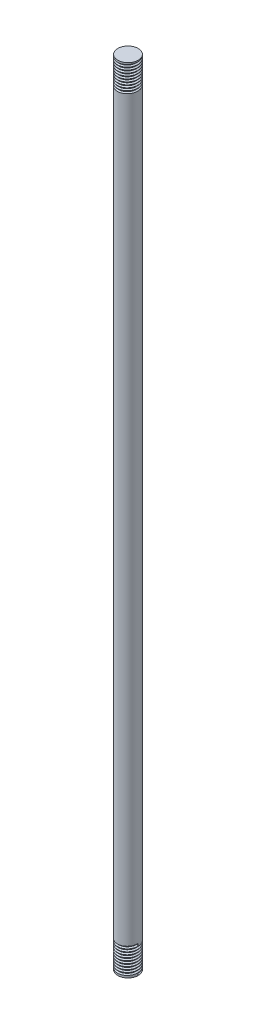
from build123d import *
from build123d.topology import SkipClean

# Parameters (mm, degrees)
SKETCH1_R           = 4
BOSS_EXTRUDE1_DEPTH = 310
THREAD1_PITCH       = 1
THREAD2_PITCH       = 1


with BuildPart() as part:
    # Sketch1 → Boss-Extrude1 (new body)
    with BuildSketch(Plane(origin=(0, 0, 0), x_dir=(1, 0, 0), z_dir=(0, 1, 0))):
        with Locations(Location((0, 0, 0), (0, 0, 270))):
            Circle(SKETCH1_R)
    extrude(amount=BOSS_EXTRUDE1_DEPTH)

    # Thread1: the profile of Thread Profile1 profile screwed along a right-hand helix of 10 turns, 8 arcs to a turn; built about Z, then put on its axis
    thread1_z = Axis((0, 0, 0), (0, 0, 1))
    thread1_corners = [(4.0003, 0, -0.000173205), (4.0003, 0, 0.875173202), (3.458734125, 0, 0.562499999), (3.458734125, 0, 0.312499999)]
    with BuildLine(mode=Mode.PRIVATE) as thread1_profile:
        Line(thread1_corners[0], thread1_corners[1])
        Line(thread1_corners[1], thread1_corners[2])
        Line(thread1_corners[2], thread1_corners[3])
        Line(thread1_corners[3], thread1_corners[0])
    thread1_cap = Face(thread1_profile.wire())
    thread1_turn_angles = [0, 22.5, 45, 67.5, 90, 112.5, 135, 157.5, 180, 202.5, 225, 247.5, 270, 292.5, 315, 337.5, 360]
    thread1_turn_weights = [1, 0.9238795325112867, 1, 0.9238795325112867, 1, 0.9238795325112867, 1, 0.9238795325112867, 1, 0.9238795325112867, 1, 0.9238795325112867, 1, 0.9238795325112867, 1, 0.9238795325112867, 1]
    thread1_turn_rails = [Edge.make_bspline([Vector(p[0], p[1], 0).rotate(thread1_z, thread1_turn_angles[k]) / thread1_turn_weights[k] + Vector(0, 0, p[2] + THREAD1_PITCH * thread1_turn_angles[k] / 360) for k in range(17)], [0, 0, 0, 1, 1, 2, 2, 3, 3, 4, 4, 5, 5, 6, 6, 7, 7, 8, 8, 8], 2, thread1_turn_weights) for p in thread1_corners]
    thread1_turn_sides = [Face.make_surface_from_curves(thread1_turn_rails[p[0]], thread1_turn_rails[p[1]]) for p in [(0, 1), (1, 2), (2, 3), (3, 0)]]
    thread1 = Plane(origin=(0, 310, 0), x_dir=(-1, 0, 0), z_dir=(0, -1, 0)) * Solid(Shell([*[p.moved(Location((0, 0, THREAD1_PITCH * i))) for i in range(10) for p in thread1_turn_sides], thread1_cap, thread1_cap.rotate(thread1_z, 3600).moved(Location((0, 0, THREAD1_PITCH * 3600 / 360)))]))
    add(thread1, mode=Mode.SUBTRACT)

    # Thread2: the profile of Thread Profile2 profile screwed along a right-hand helix of 10 turns, 8 arcs to a turn; built about Z, then put on its axis
    with SkipClean():  # the faces are left unmerged after this step: merging them gives an invalid solid
        thread2_z = Axis((0, 0, 0), (0, 0, 1))
        thread2_corners = [(4.0003, 0, -0.000173205), (4.0003, 0, 0.875173202), (3.458734125, 0, 0.562499999), (3.458734125, 0, 0.312499999)]
        with BuildLine(mode=Mode.PRIVATE) as thread2_profile:
            Line(thread2_corners[0], thread2_corners[1])
            Line(thread2_corners[1], thread2_corners[2])
            Line(thread2_corners[2], thread2_corners[3])
            Line(thread2_corners[3], thread2_corners[0])
        thread2_cap = Face(thread2_profile.wire())
        thread2_turn_angles = [0, 22.5, 45, 67.5, 90, 112.5, 135, 157.5, 180, 202.5, 225, 247.5, 270, 292.5, 315, 337.5, 360]
        thread2_turn_weights = [1, 0.9238795325112867, 1, 0.9238795325112867, 1, 0.9238795325112867, 1, 0.9238795325112867, 1, 0.9238795325112867, 1, 0.9238795325112867, 1, 0.9238795325112867, 1, 0.9238795325112867, 1]
        thread2_turn_rails = [Edge.make_bspline([Vector(p[0], p[1], 0).rotate(thread2_z, thread2_turn_angles[k]) / thread2_turn_weights[k] + Vector(0, 0, p[2] + THREAD2_PITCH * thread2_turn_angles[k] / 360) for k in range(17)], [0, 0, 0, 1, 1, 2, 2, 3, 3, 4, 4, 5, 5, 6, 6, 7, 7, 8, 8, 8], 2, thread2_turn_weights) for p in thread2_corners]
        thread2_turn_sides = [Face.make_surface_from_curves(thread2_turn_rails[p[0]], thread2_turn_rails[p[1]]) for p in [(0, 1), (1, 2), (2, 3), (3, 0)]]
        thread2 = Plane(origin=(0, 0, 0), x_dir=(1, 0, 0), z_dir=(0, 1, 0)) * Solid(Shell([*[p.moved(Location((0, 0, THREAD2_PITCH * i))) for i in range(10) for p in thread2_turn_sides], thread2_cap, thread2_cap.rotate(thread2_z, 3600).moved(Location((0, 0, THREAD2_PITCH * 3600 / 360)))]))
        add(thread2, mode=Mode.SUBTRACT)


solid = part.part
